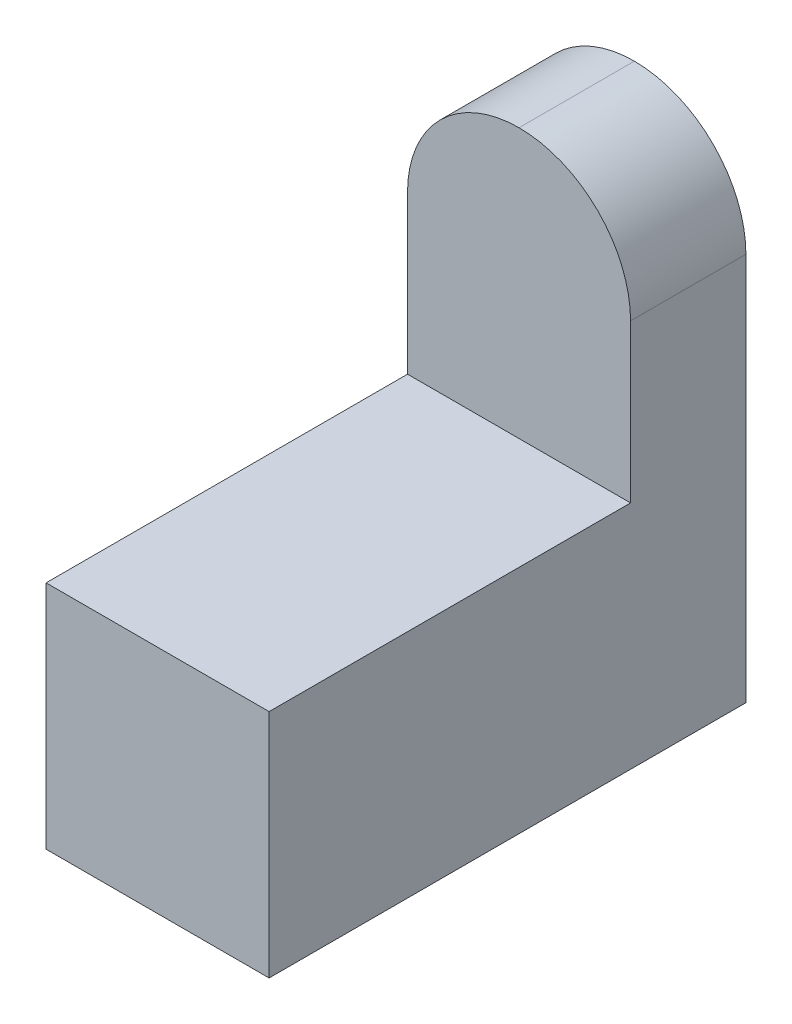
from build123d import *

# Parameters (mm, degrees)
BOSS_EXTRUDE1_DEPTH = 14.5
FILLET2_R           = 14.5


with BuildPart() as part:
    # Sketch1 → Boss-Extrude1 (new, symmetric)
    with BuildSketch(Plane.YZ):
        Polygon((0, 0), (0, 62), (30, 62), (30, 15), (65, 15), (65, 0), align=None)
    extrude(amount=BOSS_EXTRUDE1_DEPTH, both=True)

    # Fillet2
    fillet2_edges = [part.edges().sort_by_distance(p)[0] for p in [
        (-14.5, 65, 7.5),
        (14.5, 65, 7.5),
    ]]
    fillet(fillet2_edges, radius=FILLET2_R - 0.0001)  # a hair under: the kernel refuses the full size


solid = part.part
